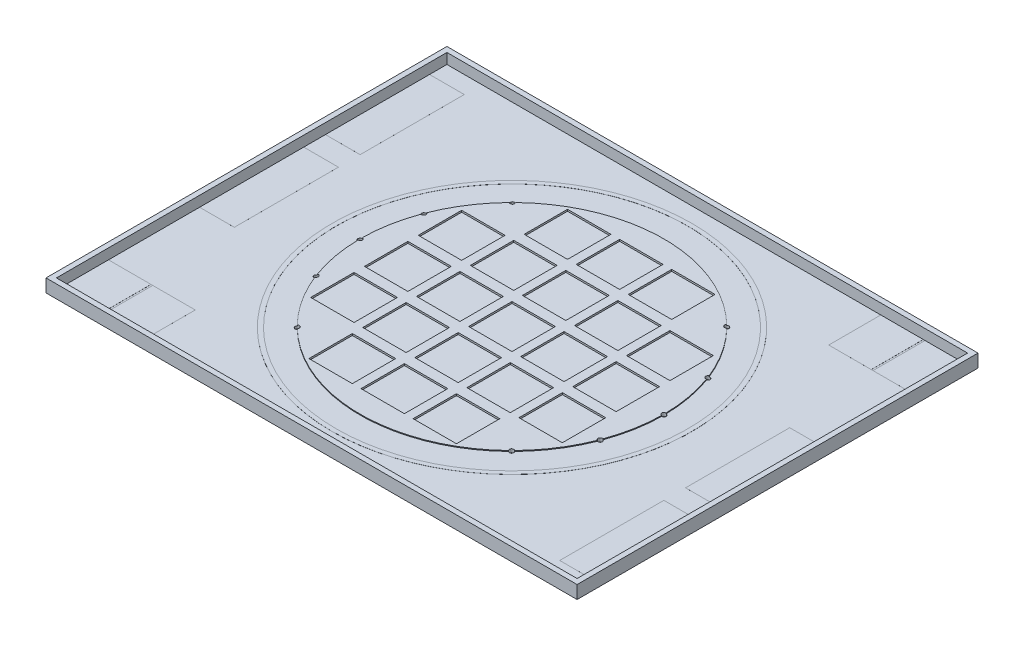
from build123d import *

# Parameters (mm, degrees)
SKETCH1_W           = 6120
SKETCH1_H           = 4620
BOSS_EXTRUDE1_DEPTH = 30
SKETCH2_W           = 6120
SKETCH2_H           = 4620
SKETCH2_W_2         = 6000
SKETCH2_H_2         = 4500
BOSS_EXTRUDE2_DEPTH = 120
SKETCH3_R           = 1750
BOSS_EXTRUDE3_DEPTH = 10
SKETCH4_W           = 500
SKETCH4_H           = 500
CUT_EXTRUDE1_DEPTH  = 20
SKETCH12_R          = 2075
SKETCH12_R_2        = 2025
BOSS_EXTRUDE8_DEPTH = 1
SKETCH13_W          = 1000
SKETCH13_H          = 600
SKETCH13_W_2        = 400
SKETCH13_H_2        = 1200
BOSS_EXTRUDE9_DEPTH = 0.1
SKETCH14_R          = 25
CUT_EXTRUDE2_DEPTH  = 40
SKETCH15_W          = 20
SKETCH15_H          = 600
CUT_EXTRUDE3_DEPTH  = 1


with BuildPart() as part:
    # Sketch1 → Boss-Extrude1 (new body)
    with BuildSketch(Plane(origin=(0, 0, 0), x_dir=(1, 0, 0), z_dir=(0, 1, 0))):
        Rectangle(SKETCH1_W, SKETCH1_H)
    extrude(amount=BOSS_EXTRUDE1_DEPTH)

    # Sketch2 → Boss-Extrude2 (add)
    with BuildSketch(Plane(origin=(0, 30, 0), x_dir=(1, 0, 0), z_dir=(0, 1, 0))):
        Rectangle(SKETCH2_W, SKETCH2_H)
        Rectangle(SKETCH2_W_2, SKETCH2_H_2, mode=Mode.SUBTRACT)
    extrude(amount=BOSS_EXTRUDE2_DEPTH)

    # Sketch3 → Boss-Extrude3 (add)
    with BuildSketch(Plane(origin=(0, 30, 0), x_dir=(1, 0, 0), z_dir=(0, 1, 0))):
        Circle(SKETCH3_R)
    extrude(amount=BOSS_EXTRUDE3_DEPTH)

    # Sketch4 → Cut-Extrude1 (cut)
    with BuildSketch(Plane(origin=(0, 40, 0), x_dir=(1, 0, 0), z_dir=(0, 1, 0))):
        with Locations((600, 0)):
            Rectangle(SKETCH4_W, SKETCH4_H)
        Rectangle(SKETCH4_W, SKETCH4_H)
        with Locations((1200, 0)):
            Rectangle(SKETCH4_W, SKETCH4_H)
        with Locations((-1200, 0)):
            Rectangle(SKETCH4_W, SKETCH4_H)
        with Locations((-600, 0)):
            Rectangle(SKETCH4_W, SKETCH4_H)
        with Locations((0, 620)):
            Rectangle(SKETCH4_W, SKETCH4_H)
        with Locations((-600, 620)):
            Rectangle(SKETCH4_W, SKETCH4_H)
        with Locations((600, 620)):
            Rectangle(SKETCH4_W, SKETCH4_H)
        with Locations((0, 1240)):
            Rectangle(SKETCH4_W, SKETCH4_H)
        with Locations((-600, 1240)):
            Rectangle(SKETCH4_W, SKETCH4_H)
        with Locations((600, 1240)):
            Rectangle(SKETCH4_W, SKETCH4_H)
        with Locations((600, -1240)):
            Rectangle(SKETCH4_W, SKETCH4_H)
        with Locations((-600, -1240)):
            Rectangle(SKETCH4_W, SKETCH4_H)
        with Locations((0, -1240)):
            Rectangle(SKETCH4_W, SKETCH4_H)
        with Locations((600, -620)):
            Rectangle(SKETCH4_W, SKETCH4_H)
        with Locations((-600, -620)):
            Rectangle(SKETCH4_W, SKETCH4_H)
        with Locations((0, -620)):
            Rectangle(SKETCH4_W, SKETCH4_H)
        with Locations((-1200, 620)):
            Rectangle(SKETCH4_W, SKETCH4_H)
        with Locations((1200, 620)):
            Rectangle(SKETCH4_W, SKETCH4_H)
        with Locations((1200, -620)):
            Rectangle(SKETCH4_W, SKETCH4_H)
        with Locations((-1200, -620)):
            Rectangle(SKETCH4_W, SKETCH4_H)
    extrude(amount=-CUT_EXTRUDE1_DEPTH, mode=Mode.SUBTRACT)

    # Sketch12 → Boss-Extrude8 (add)
    with BuildSketch(Plane(origin=(0, 30, 0), x_dir=(1, 0, 0), z_dir=(0, 1, 0))):
        Circle(SKETCH12_R)
        Circle(SKETCH12_R_2, mode=Mode.SUBTRACT)
    extrude(amount=BOSS_EXTRUDE8_DEPTH)

    # Sketch13 → Boss-Extrude9 (add)
    with BuildSketch(Plane(origin=(0, 30, 0), x_dir=(1, 0, 0), z_dir=(0, 1, 0))):
        with Locations((-2500, -1950)):
            Rectangle(SKETCH13_W, SKETCH13_H)
        with Locations((-2800, 0)):
            Rectangle(SKETCH13_W_2, SKETCH13_H_2)
        with Locations((-2800, 1450)):
            Rectangle(SKETCH13_W_2, SKETCH13_H_2)
        with Locations((2500, 1950)):
            Rectangle(SKETCH13_W, SKETCH13_H)
        with Locations((2800, 0)):
            Rectangle(SKETCH13_W_2, SKETCH13_H_2)
        with Locations((2800, -1450)):
            Rectangle(SKETCH13_W_2, SKETCH13_H_2)
    extrude(amount=BOSS_EXTRUDE9_DEPTH)

    # Sketch14 → Cut-Extrude2 (cut)
    with BuildSketch(Plane(origin=(0, 40, 0), x_dir=(1, 0, 0), z_dir=(0, 1, 0))):
        with Locations((-1636.490146625, -620)):
            Circle(SKETCH14_R)
        with Locations((-1234.868414043, -1240)):
            Circle(SKETCH14_R)
        with Locations((-1750, 0)):
            Circle(SKETCH14_R)
        with Locations((-1636.490146625, 620)):
            Circle(SKETCH14_R)
        with Locations((-1234.868414043, 1240)):
            Circle(SKETCH14_R)
        with Locations((1234.868414043, 1240)):
            Circle(SKETCH14_R)
        with Locations((1636.490146625, 620)):
            Circle(SKETCH14_R)
        with Locations((1750, 0)):
            Circle(SKETCH14_R)
        with Locations((1234.868414043, -1240)):
            Circle(SKETCH14_R)
        with Locations((1636.490146625, -620)):
            Circle(SKETCH14_R)
    extrude(amount=-CUT_EXTRUDE2_DEPTH, mode=Mode.SUBTRACT)

    # Sketch15 → Cut-Extrude3 (cut)
    with BuildSketch(Plane(origin=(0, 30.1, 0), x_dir=(1, 0, 0), z_dir=(0, 1, 0))):
        with Locations((-2500, -1950)):
            Rectangle(SKETCH15_W, SKETCH15_H)
        with Locations((2500, 1950)):
            Rectangle(SKETCH15_W, SKETCH15_H)
    extrude(amount=-CUT_EXTRUDE3_DEPTH, mode=Mode.SUBTRACT)


solid = part.part
